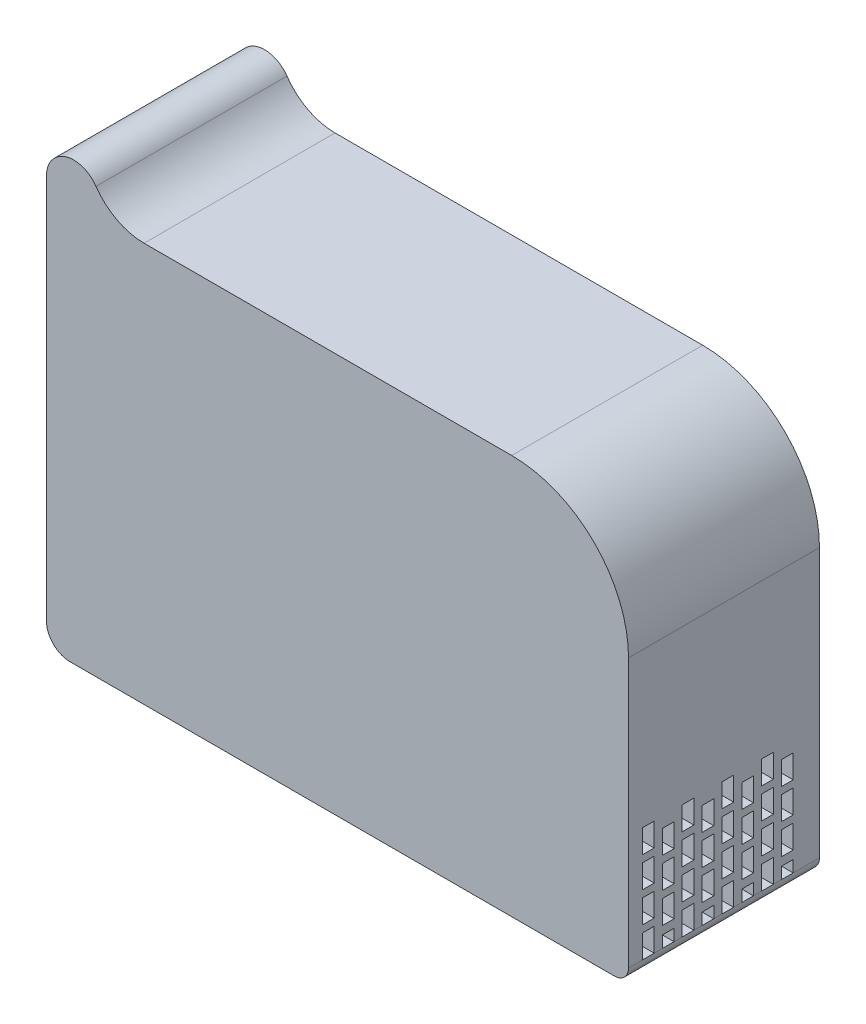
from build123d import *
from build123d.topology import SkipClean

# Parameters (mm, degrees)
FLOOR_2_DEPTH                = 2.4
FLOOR_2_2_DEPTH              = 2.4
FLOOR_2_3_DEPTH              = 2.4
BEARING_LIP_DEPTH            = 0.6
WALLS_DEPTH                  = 66
BEARING_SLEEVE_DEPTH         = 15.6
UPPER_BEARINGLIP_DEPTH       = 0.6
WIRE_GUARD_DEPTH             = 24
MOT_SHELF_DEPTH              = 28
SKETCH1_10_W                 = 2.4
SKETCH1_10_H                 = 8.95
BOT_MOT_SUPPORTS_DEPTH       = 35
TOP_MOT_SUPPORTS_DEPTH       = 7
SKETCH3_W                    = 2.4
SKETCH3_H                    = 8.95
TOP_MOT_SUPPORTS_2_DEPTH     = 7
TOP_MOT_SUPPORTS_3_DEPTH     = 7
SKETCH3_5_W                  = 99.652053124
SKETCH3_5_H                  = 32.7
TOP_DEPTH                    = 2.4
FILLET3_R                    = 20
MOT_SHELF_MATERIAL_REMOVAL_W = 38.7
MOT_SHELF_MATERIAL_REMOVAL_H = 16
CUT_EXTRUDE1_DEPTH           = 4
SCREW_HOLE_EXTRUDE_START     = -1
SCREW_HOLE_EXTRUDE_OUTLINE_R = 2.25
SCREW_HOLE_EXTRUDE_DEPTH     = 31.3
SCREW_SUPPORT_2_R            = 4.25
SCREW_SUPPORT_2_R_2          = 2.25
SCREW_HOLE_2_DEPTH           = 30.3
SCREW_SUPPORT_2_2_R          = 2.25
CUT_EXTRUDE2_DEPTH           = 30.3
TOP_SCREW_9_R                = 2.25
CUT_EXTRUDE6_DEPTH           = 100
TOP_SCREW_SKIN_START         = 30.3
TOP_SCREW_SKIN_DEPTH         = 2.4
TOP_SCREW_HOLE_DEPTH         = 30.3
TOP_SCREW_FILLET_R           = 10
FILLET5_R                    = 4
FILLET7_START                = -1
FILLET7_DEPTH                = 35
CHAMFER2_SIZE                = 2.4
BOSS_EXTRUDE3_DEPTH          = 27.9
FILLET8_R                    = 2.4
FILLET9_R                    = 2
SCREW_HOLE_3_R               = 2.25
BOSS_EXTRUDE4_DEPTH          = 30.3
SCREW_SUPPORT_7_R            = 2.25
CUT_EXTRUDE4_DEPTH           = 100
LED_RESET_HOLES_W            = 2
LED_RESET_HOLES_H            = 4
LED_RESET_HOLES_H_2          = 2
CUT_EXTRUDE5_DEPTH           = 5.5


with BuildPart() as part:
    # Sketch1 → Floor 2 (new body)
    with BuildSketch(Plane(origin=(0, 0, 0), x_dir=(1, 0, 0), z_dir=(0, 1, 0))):
        with BuildLine():
            Line((-15.15, 0), (-22, 0))
            ThreePointArc((-22, 0), (-17.331783846, -13.550249766), (-5.308248299, -21.35))
            Line((-5.308248299, -21.35), (-5.308248299, -30.3))
            Line((-5.308248299, -30.3), (0.5, -30.3))
            Line((0.5, -30.3), (0.5, -29.955960578))
            ThreePointArc((0.5, -29.955960578), (0.001325615, -30.119809063), (-0.5, -30.27535679))
            Line((-0.5, -30.27535679), (-0.5, -15.141746927))
            ThreePointArc((-0.5, -15.141746927), (-10.88800946, -10.534407909), (-15.15, 0))
        make_face()
    extrude(amount=FLOOR_2_DEPTH)


with BuildPart() as body_2:
    # Sketch1 → Floor 2 2 (new body)
    with BuildSketch(Plane(origin=(0, 0, 0), x_dir=(1, 0, 0), z_dir=(0, 1, 0))):
        with BuildLine():
            ThreePointArc((15.15, 0), (10.88800946, -10.534407909), (0.5, -15.141746927))
            Line((0.5, -15.141746927), (0.5, -29.955960578))
            ThreePointArc((0.5, -29.955960578), (16.0686764, -18.436441998), (22, 0))
            Line((22, 0), (15.15, 0))
        make_face()
    extrude(amount=FLOOR_2_2_DEPTH)


with BuildPart() as body_3:
    # Sketch1 → Floor 2 3 (new body)
    with BuildSketch(Plane(origin=(0, 0, 0), x_dir=(1, 0, 0), z_dir=(0, 1, 0))):
        with BuildLine():
            Line((46.843804825, -30.3), (46.843804825, 0))
            Line((46.843804825, 0), (24, 0))
            ThreePointArc((24, 0), (18.84061337, -17.896529995), (4.946046515, -30.3))
            Line((4.946046515, -30.3), (46.843804825, -30.3))
        make_face()
    extrude(amount=FLOOR_2_3_DEPTH)


with BuildPart() as body_4:
    # Sketch1<5> → Bearing_Lip (new body)
    with BuildSketch(Plane(origin=(0, 0, 0), x_dir=(1, 0, 0), z_dir=(0, 1, 0))):
        with BuildLine():
            Line((-9.15, 0), (-11.15, 0))
            ThreePointArc((-11.15, 0), (0, -11.15), (11.15, 0))
            Line((11.15, 0), (9.15, 0))
            ThreePointArc((9.15, 0), (0, -9.15), (-9.15, 0))
        make_face()
    extrude(amount=BEARING_LIP_DEPTH)


with BuildPart() as body_5:
    # Sketch1<6> → Walls (new body)
    with BuildSketch(Plane(origin=(0, 0, 0), x_dir=(1, 0, 0), z_dir=(0, 1, 0))):
        Polygon((-45.608248299, -30.3), (-48.008248299, -30.3), (-48.008248299, -21.35), (-48.008248299, 0), (-50.408248299, 0), (-50.408248299, -32.7), (49.243804825, -32.7), (49.243804825, 0), (46.843804825, 0), (46.843804825, -30.3), (4.946046515, -30.3), (0.5, -30.3), (-0.5, -30.3), (-0.582221737, -30.3), (-5.308248299, -30.3), (-7.708248299, -30.3), (-25.458248299, -30.3), (-27.858248299, -30.3), align=None)
    extrude(amount=WALLS_DEPTH)

    # Sketch3<5> → Top (add)
    with BuildSketch(Plane(origin=(0, 66, 0), x_dir=(1, 0, 0), z_dir=(0, 1, 0))):
        with Locations((-0.582221737, -16.35)):
            Rectangle(SKETCH3_5_W, SKETCH3_5_H)
    extrude(amount=TOP_DEPTH)

    # Fillet3
    fillet3_edges = [body_5.edges().sort_by_distance(p)[0] for p in [
        (46.843804825, 66, 15.15),
        (49.243804825, 68.4, 16.35),
    ]]
    fillet(fillet3_edges, radius=FILLET3_R)

    # Screw_Hole-Extrude: read off the stored shape, not the designer's step
    # Screw_Hole-Extrude outline → Screw_Hole-Extrude (add)
    with BuildSketch(Plane(origin=(0, 0, 30.3), x_dir=(-1, 0, 0), z_dir=(0, 0, -1)).offset(SCREW_HOLE_EXTRUDE_START)):
        with BuildLine():
            Line((-23.65, 2.4), (-15.15, 2.4))
            Line((-15.15, 2.4), (-15.15, 10.9))
            Line((-15.15, 10.9), (-19.4, 10.9))
            ThreePointArc((-19.4, 10.9), (-22.40520382, 9.65520382), (-23.65, 6.65))
            Line((-23.65, 6.65), (-23.65, 2.4))
        make_face()
        with Locations((-19.4, 6.65)):
            Circle(SCREW_HOLE_EXTRUDE_OUTLINE_R, mode=Mode.SUBTRACT)
    extrude(amount=SCREW_HOLE_EXTRUDE_DEPTH)

    # Top_Screw<9> → Cut-Extrude6 (cut)
    with BuildSketch(Plane(origin=(0, 0, 30.3), x_dir=(-1, 0, 0), z_dir=(0, 0, -1))):
        with Locations((45.758248299, 70.06939799)):
            Circle(TOP_SCREW_9_R)
    extrude(amount=CUT_EXTRUDE6_DEPTH, mode=Mode.SUBTRACT)

    # Top_Screw_Skin: read off the stored shape, not the designer's step
    # Top_Screw_Skin outline → Top_Screw_Skin (add)
    with BuildSketch(Plane.XY.offset(TOP_SCREW_SKIN_START)):
        with BuildLine():
            Line((-41.108248299, 68.4), (-41.108248299, 70.06939799))
            ThreePointArc((-41.108248299, 70.06939799), (-45.758248299, 74.71939799), (-50.408248299, 70.06939799))
            Line((-50.408248299, 70.06939799), (-50.408248299, 68.4))
            Line((-50.408248299, 68.4), (-41.108248299, 68.4))
        make_face()
    extrude(amount=TOP_SCREW_SKIN_DEPTH)

    # Top_Screw → Top_Screw_Hole (add)
    with SkipClean():  # the faces are left unmerged after this step: merging them gives an invalid solid
        with BuildSketch(Plane(origin=(0, 0, 30.3), x_dir=(-1, 0, 0), z_dir=(0, 0, -1))):
            with BuildLine():
                ThreePointArc((50.408248299, 70.06939799), (45.758248299, 74.71939799), (41.108248299, 70.06939799))
                Line((41.108248299, 70.06939799), (43.508248299, 70.06939799))
                ThreePointArc((43.508248299, 70.06939799), (45.758248299, 72.31939799), (48.008248299, 70.06939799))
                ThreePointArc((48.008248299, 70.06939799), (47.814537847, 69.156067112), (47.266760927, 68.4))
                Line((47.266760927, 68.4), (50.098249491, 68.4))
                Line((50.098249491, 68.4), (50.408248299, 68.4))
                Line((50.408248299, 68.4), (50.408248299, 70.06939799))
            make_face()
            with BuildLine():
                Line((41.108248299, 70.06939799), (41.108248299, 68.4))
                Line((41.108248299, 68.4), (41.418247106, 68.4))
                Line((41.418247106, 68.4), (44.24973567, 68.4))
                ThreePointArc((44.24973567, 68.4), (43.70195875, 69.156067112), (43.508248299, 70.06939799))
                Line((43.508248299, 70.06939799), (41.108248299, 70.06939799))
            make_face()
        extrude(amount=TOP_SCREW_HOLE_DEPTH)

    # Top_Screw_Fillet
    # the kernel refuses this fillet: 10 mm, written as the material it adds along each edge
    with BuildSketch(Plane(origin=(-41.108248299, 68.4, 30.3), x_dir=(1, 0, 0), z_dir=(0, 0, -1))) as top_screw_fillet_piece_1:
        with BuildLine():
            CenterArc((7.400874248, -10), TOP_SCREW_FILLET_R, 90, 55.344433168)
            Line((-0.824978481, -4.313582246), (-1.647563754, -3.74494047))
            ThreePointArc((-1.647563754, -3.74494047), (-1, -1.66939799), (-1, 0))
            Line((-1, 0), (0, 1))
            Line((0, 1), (7.400874248, 1))
            Line((7.400874248, 1), (7.400874248, 0))
        make_face()
    extrude(amount=30.3)
    with BuildSketch(Plane(origin=(-41.108248299, 68.4, 30.3), x_dir=(1, 0, 0), z_dir=(0, 0, 1))) as top_screw_fillet_piece_2:
        with BuildLine():
            CenterArc((7.400874248, 10), TOP_SCREW_FILLET_R, 214.655566832, 55.344433168)
            Line((-0.824978481, 4.313582246), (-1.647563754, 3.74494047))
            ThreePointArc((-1.647563754, 3.74494047), (-1, 1.66939799), (-1, 0))
            Line((-1, 0), (0, -1))
            Line((0, -1), (7.400874248, -1))
            Line((7.400874248, -1), (7.400874248, 0))
        make_face()
    extrude(amount=2.4)

    # Fillet5
    fillet5_edges = [body_5.edges().sort_by_distance(p)[0] for p in [
        (-50.408248299, 0, 16.35),
    ]]
    fillet(fillet5_edges, radius=FILLET5_R)

    # Fillet7: read off the stored shape, not the designer's step
    # Fillet7 outline → Fillet7 (cut)
    with BuildSketch(Plane.XY.offset(FILLET7_START)):
        with BuildLine():
            Line((49.243804825, 0), (49.243804825, 2.4))
            ThreePointArc((49.243804825, 2.4), (48.5408611, 0.702943725), (46.843804825, 0))
            Line((46.843804825, 0), (49.243804825, 0))
        make_face()
    extrude(amount=FILLET7_DEPTH, mode=Mode.SUBTRACT)

    # PCB_Mount → Boss-Extrude3 (add)
    with BuildSketch(Plane(origin=(0, 0, 30.3), x_dir=(-1, 0, 0), z_dir=(0, 0, -1))):
        with BuildLine():
            ThreePointArc((-40.405146941, 60.7), (-41.110093155, 60.016883294), (-41.780671966, 59.3))
            Line((-41.780671966, 59.3), (-40.243804825, 59.3))
            Line((-40.243804825, 59.3), (-40.243804825, 57.9))
            Line((-40.243804825, 57.9), (-38.843804825, 57.9))
            Line((-38.843804825, 57.9), (-38.843804825, 59.3))
            Line((-38.843804825, 59.3), (-36.843804825, 59.3))
            Line((-36.843804825, 59.3), (-36.843804825, 57.9))
            Line((-36.843804825, 57.9), (-35.443804825, 57.9))
            Line((-35.443804825, 57.9), (-35.443804825, 60.7))
            Line((-35.443804825, 60.7), (-40.405146941, 60.7))
        make_face()
        Polygon((-46.843804825, 23.8), (-46.843804825, 22.4), (-35.443804825, 22.4), (-35.443804825, 25.2), (-36.843804825, 25.2), (-36.843804825, 23.8), (-38.843804825, 23.8), (-38.843804825, 25.2), (-40.243804825, 25.2), (-40.243804825, 23.8), align=None)
    extrude(amount=BOSS_EXTRUDE3_DEPTH)

    # Screw_Hole_3 → Boss-Extrude4 (add)
    with BuildSketch(Plane(origin=(0, 0, 30.3), x_dir=(-1, 0, 0), z_dir=(0, 0, -1))):
        with BuildLine():
            Line((-16.217778263, 66), (-16.217778263, 61.75))
            ThreePointArc((-16.217778263, 61.75), (-11.967778263, 57.5), (-7.717778263, 61.75))
            Line((-7.717778263, 61.75), (-7.717778263, 66))
            Line((-7.717778263, 66), (-16.217778263, 66))
        make_face()
        with Locations(Location((-11.967778263, 61.75, 0), (0, 0, 180))):
            Circle(SCREW_HOLE_3_R, mode=Mode.SUBTRACT)
    extrude(amount=BOSS_EXTRUDE4_DEPTH)

    # led_reset_holes → Cut-Extrude5 (cut)
    with BuildSketch(Plane.ZY.offset(-46.843804825)):
        with Locations((29.3, 20)):
            Rectangle(LED_RESET_HOLES_W, LED_RESET_HOLES_H)
        with Locations((22.5, 20)):
            Rectangle(LED_RESET_HOLES_W, LED_RESET_HOLES_H)
        with Locations((19.1, 18.2)):
            Rectangle(LED_RESET_HOLES_W, LED_RESET_HOLES_H)
        with Locations((15.7, 20)):
            Rectangle(LED_RESET_HOLES_W, LED_RESET_HOLES_H)
        with Locations((12.3, 18.2)):
            Rectangle(LED_RESET_HOLES_W, LED_RESET_HOLES_H)
        with Locations((8.9, 20)):
            Rectangle(LED_RESET_HOLES_W, LED_RESET_HOLES_H)
        with Locations((5.5, 18.2)):
            Rectangle(LED_RESET_HOLES_W, LED_RESET_HOLES_H)
        with Locations((5.5, 13)):
            Rectangle(LED_RESET_HOLES_W, LED_RESET_HOLES_H)
        with Locations((5.5, 7.8)):
            Rectangle(LED_RESET_HOLES_W, LED_RESET_HOLES_H)
        with Locations((5.5, 3.4)):
            Rectangle(LED_RESET_HOLES_W, LED_RESET_HOLES_H_2)
        with Locations((8.9, 4.4)):
            Rectangle(LED_RESET_HOLES_W, LED_RESET_HOLES_H)
        with Locations((8.9, 9.6)):
            Rectangle(LED_RESET_HOLES_W, LED_RESET_HOLES_H)
        with Locations((8.9, 14.8)):
            Rectangle(LED_RESET_HOLES_W, LED_RESET_HOLES_H)
        with Locations((12.3, 13)):
            Rectangle(LED_RESET_HOLES_W, LED_RESET_HOLES_H)
        with Locations((12.3, 7.8)):
            Rectangle(LED_RESET_HOLES_W, LED_RESET_HOLES_H)
        with Locations((15.7, 4.4)):
            Rectangle(LED_RESET_HOLES_W, LED_RESET_HOLES_H)
        with Locations((15.7, 9.6)):
            Rectangle(LED_RESET_HOLES_W, LED_RESET_HOLES_H)
        with Locations((15.7, 14.8)):
            Rectangle(LED_RESET_HOLES_W, LED_RESET_HOLES_H)
        with Locations((19.1, 13)):
            Rectangle(LED_RESET_HOLES_W, LED_RESET_HOLES_H)
        with Locations((19.1, 7.8)):
            Rectangle(LED_RESET_HOLES_W, LED_RESET_HOLES_H)
        with Locations((19.1, 3.4)):
            Rectangle(LED_RESET_HOLES_W, LED_RESET_HOLES_H_2)
        with Locations((22.5, 4.4)):
            Rectangle(LED_RESET_HOLES_W, LED_RESET_HOLES_H)
        with Locations((22.5, 9.6)):
            Rectangle(LED_RESET_HOLES_W, LED_RESET_HOLES_H)
        with Locations((22.5, 14.8)):
            Rectangle(LED_RESET_HOLES_W, LED_RESET_HOLES_H)
        with Locations((25.9, 13)):
            Rectangle(LED_RESET_HOLES_W, LED_RESET_HOLES_H)
        with Locations((25.9, 7.8)):
            Rectangle(LED_RESET_HOLES_W, LED_RESET_HOLES_H)
        with Locations((29.3, 4.4)):
            Rectangle(LED_RESET_HOLES_W, LED_RESET_HOLES_H)
        with Locations((29.3, 9.6)):
            Rectangle(LED_RESET_HOLES_W, LED_RESET_HOLES_H)
        with Locations((25.9, 18.2)):
            Rectangle(LED_RESET_HOLES_W, LED_RESET_HOLES_H)
        with Locations((12.3, 3.4)):
            Rectangle(LED_RESET_HOLES_W, LED_RESET_HOLES_H_2)
        with Locations((25.9, 3.4)):
            Rectangle(LED_RESET_HOLES_W, LED_RESET_HOLES_H_2)
        with Locations((29.3, 14.8)):
            Rectangle(LED_RESET_HOLES_W, LED_RESET_HOLES_H)
    extrude(amount=-CUT_EXTRUDE5_DEPTH, mode=Mode.SUBTRACT)


with BuildPart() as body_6:
    # Sketch1<7> → Bearing_Sleeve (new body)
    with BuildSketch(Plane(origin=(0, 0, 0), x_dir=(1, 0, 0), z_dir=(0, 1, 0))):
        with BuildLine():
            Line((-11.15, 0), (-15.15, 0))
            ThreePointArc((-15.15, 0), (-10.88800946, -10.534407909), (-0.5, -15.141746927))
            Line((-0.5, -15.141746927), (-0.5, -30.27535679))
            ThreePointArc((-0.5, -30.27535679), (0.001325615, -30.119809063), (0.5, -29.955960578))
            Line((0.5, -29.955960578), (0.5, -15.141746927))
            ThreePointArc((0.5, -15.141746927), (10.88800946, -10.534407909), (15.15, 0))
            Line((15.15, 0), (11.15, 0))
            ThreePointArc((11.15, 0), (0, -11.15), (-11.15, 0))
        make_face()
    extrude(amount=BEARING_SLEEVE_DEPTH)

    # Sketch6 → Upper_BearingLip (add)
    with BuildSketch(Plane(origin=(0, 15.6, 0), x_dir=(1, 0, 0), z_dir=(0, 1, 0))):
        with BuildLine():
            Line((-9.15, 0), (-11.15, 0))
            ThreePointArc((-11.15, 0), (0, -11.15), (11.15, 0))
            Line((11.15, 0), (9.15, 0))
            ThreePointArc((9.15, 0), (0, -9.15), (-9.15, 0))
        make_face()
    extrude(amount=-UPPER_BEARINGLIP_DEPTH)


with BuildPart() as body_7:
    # Sketch1<8> → Wire_Guard (new body)
    with BuildSketch(Plane(origin=(0, 0, 0), x_dir=(1, 0, 0), z_dir=(0, 1, 0))):
        with BuildLine():
            ThreePointArc((4.946046515, -30.3), (18.84061337, -17.896529995), (24, 0))
            Line((24, 0), (22, 0))
            ThreePointArc((22, 0), (16.0686764, -18.436441998), (0.5, -29.955960578))
            Line((0.5, -29.955960578), (0.5, -30.3))
            Line((0.5, -30.3), (4.946046515, -30.3))
        make_face()
    extrude(amount=WIRE_GUARD_DEPTH)

    # Screw_Support<7> → Cut-Extrude4 (cut)
    with BuildSketch(Plane(origin=(0, 0, 30.3), x_dir=(-1, 0, 0), z_dir=(0, 0, -1))):
        with Locations(Location((-19.4, 6.65, 0), (0, 0, 180))):
            Circle(SCREW_SUPPORT_7_R)
    extrude(amount=CUT_EXTRUDE4_DEPTH, mode=Mode.SUBTRACT)


with BuildPart() as body_8:
    # Sketch1<9> → Mot_Shelf (new body)
    with BuildSketch(Plane(origin=(0, 0, 0), x_dir=(1, 0, 0), z_dir=(0, 1, 0))):
        with BuildLine():
            Line((-48.008248299, 0), (-48.008248299, -21.35))
            Line((-48.008248299, -21.35), (-45.608248299, -21.35))
            Line((-45.608248299, -21.35), (-27.858248299, -21.35))
            Line((-27.858248299, -21.35), (-25.458248299, -21.35))
            Line((-25.458248299, -21.35), (-7.708248299, -21.35))
            Line((-7.708248299, -21.35), (-5.308248299, -21.35))
            ThreePointArc((-5.308248299, -21.35), (-9.627609708, -19.78153511), (-13.526917609, -17.35))
            Line((-13.526917609, -17.35), (-44.008248299, -17.35))
            Line((-44.008248299, -17.35), (-44.008248299, 0))
            Line((-44.008248299, 0), (-48.008248299, 0))
        make_face()
    extrude(amount=MOT_SHELF_DEPTH)

    # Sketch1<10> → Bot_Mot_Supports (add)
    with BuildSketch(Plane(origin=(0, 0, 0), x_dir=(1, 0, 0), z_dir=(0, 1, 0))):
        with Locations((-6.508248299, -25.825)):
            Rectangle(SKETCH1_10_W, SKETCH1_10_H)
        with Locations((-26.658248299, -25.825)):
            Rectangle(SKETCH1_10_W, SKETCH1_10_H)
        with Locations((-46.808248299, -25.825)):
            Rectangle(SKETCH1_10_W, SKETCH1_10_H)
    extrude(amount=BOT_MOT_SUPPORTS_DEPTH)

    # mot_shelf_material_removal → Cut-Extrude1 (cut)
    with BuildSketch(Plane(origin=(0, 0, 17.35), x_dir=(-1, 0, 0), z_dir=(0, 0, -1))):
        with Locations((24.658248299, 14)):
            Rectangle(MOT_SHELF_MATERIAL_REMOVAL_W, MOT_SHELF_MATERIAL_REMOVAL_H)
    extrude(amount=-CUT_EXTRUDE1_DEPTH, mode=Mode.SUBTRACT)

    # Screw_Support 2 → Screw_Hole_2 (add)
    # profile 1 of 4: a face of its own
    with BuildSketch(Plane(origin=(0, 0, 30.3), x_dir=(-1, 0, 0), z_dir=(0, 0, -1))):
        with Locations((19.4, 6.65)):
            Circle(SCREW_SUPPORT_2_R)
        with Locations((19.4, 6.65)):
            Circle(SCREW_SUPPORT_2_R_2, mode=Mode.SUBTRACT)
    # profile 2 of 4: a face of its own
    with BuildSketch(Plane(origin=(0, 0, 30.3), x_dir=(-1, 0, 0), z_dir=(0, 0, -1))):
        with BuildLine():
            Line((15.15, 14), (15.15, 6.65))
            ThreePointArc((15.15, 6.65), (17.272569365, 10.329203568), (21.520135951, 10.333411944))
            Line((21.520135951, 10.333411944), (15.15, 14))
        make_face()
    # profile 3 of 4: a face of its own
    with BuildSketch(Plane(origin=(0, 0, 30.3), x_dir=(-1, 0, 0), z_dir=(0, 0, -1))):
        with BuildLine():
            Line((15.15, 2.4), (19.4, 2.4))
            ThreePointArc((19.4, 2.4), (16.39479618, 3.64479618), (15.15, 6.65))
            Line((15.15, 6.65), (15.15, 2.4))
        make_face()
    # profile 4 of 4: a face of its own
    with BuildSketch(Plane(origin=(0, 0, 30.3), x_dir=(-1, 0, 0), z_dir=(0, 0, -1))):
        with BuildLine():
            Line((19.4, 2.4), (22, 2.4))
            Line((22, 2.4), (23.183865445, 4.714835331))
            ThreePointArc((23.183865445, 4.714835331), (21.617887526, 3.024606929), (19.4, 2.4))
        make_face()
    extrude(amount=SCREW_HOLE_2_DEPTH)

    # Screw_Support 2<2> → Cut-Extrude2 (cut)
    with BuildSketch(Plane(origin=(0, 0, 30.3), x_dir=(-1, 0, 0), z_dir=(0, 0, -1))):
        with Locations((19.4, 6.65)):
            Circle(SCREW_SUPPORT_2_2_R)
    extrude(amount=CUT_EXTRUDE2_DEPTH, mode=Mode.SUBTRACT)

    # Chamfer2
    # the kernel refuses this chamfer: 2.4 mm, written as the material it adds along each edge
    with BuildSketch(Plane(origin=(-27.858248299, 22, 21.35), x_dir=(-1, 0, 0), z_dir=(0, 1, 0)), Plane(origin=(-25.458248299, 0, 21.35), x_dir=(0, 0, 1), z_dir=(0, 1, 0)), Plane(origin=(-27.858248299, 0, 21.35), x_dir=(-1, 0, 0), z_dir=(0, 1, 0)), Plane(origin=(-7.708248299, 22, 21.35), x_dir=(-1, 0, 0), z_dir=(0, 1, 0)), Plane(origin=(-7.708248299, 0, 21.35), x_dir=(-1, 0, 0), z_dir=(0, 1, 0))) as chamfer2_piece_1:
        Polygon((CHAMFER2_SIZE, 0), (0, CHAMFER2_SIZE), (0, 0), align=None)
    extrude(amount=6)
    with BuildSketch(Plane(origin=(-25.458248299, 22, 21.35), x_dir=(1, 0, 0), z_dir=(0, 1, 0))) as chamfer2_piece_2:
        Polygon((CHAMFER2_SIZE, 0), (0, -CHAMFER2_SIZE), (0, 0), align=None)
    extrude(amount=6)

    # Fillet8
    # the kernel refuses this fillet: 2.4 mm, written as the material it takes off along each edge
    with BuildSketch(Plane(origin=(-44.008248299, 6, 21.35), x_dir=(0, 0, -1), z_dir=(0, 1, 0))) as fillet8_piece_1:
        with BuildLine():
            CenterArc((2.2627417, 2.4), FILLET8_R, 199.471220634, 70.528779366)
            Line((0, 1.6), (-0.045254834, 1.584))
            ThreePointArc((-0.045254834, 1.584), (-0.048, 0.8), (-0.048, 0))
            Line((-0.048, 0), (0, -0.048))
            Line((0, -0.048), (2.2627417, -0.048))
            Line((2.2627417, -0.048), (2.2627417, 0))
        make_face()
    extrude(amount=16, mode=Mode.SUBTRACT)

    # Fillet9
    # the kernel refuses this fillet: 2 mm, written as the material it takes off along each edge
    with BuildSketch(Plane(origin=(-28.058248299, 0, 21.35), x_dir=(0, 1, 0), z_dir=(1, 0, 0))) as fillet9_piece_1_section:
        with BuildLine():
            CenterArc((FILLET9_R, -FILLET9_R), FILLET9_R, 90, 90)
            Line((0, -FILLET9_R), (0, 0))
            Line((0, 0), (FILLET9_R, 0))
        make_face()
    fillet9_piece_1 = extrude(amount=22.95, mode=Mode.PRIVATE)
    fillet9_piece_1 = split(fillet9_piece_1, bisect_by=Plane(origin=(-25.558248299, 0, 23.85), z_dir=(0.7071067811865476, 0, 0.7071067811865476)), keep=Keep.TOP, mode=Mode.PRIVATE)
    fillet9_piece_1 = split(fillet9_piece_1, bisect_by=Plane(origin=(-19.083248299, 0, 12.375), z_dir=(-0.7071067811865476, 0, 0.7071067811865476)), keep=Keep.TOP, mode=Mode.PRIVATE)
    add(fillet9_piece_1, mode=Mode.SUBTRACT)
    with BuildSketch(Plane(origin=(-13.643782205, 0, 17.814466094), x_dir=(0.7071067811865476, 0, -0.7071067811865476), z_dir=(0.7071067811865476, 0, 0.7071067811865476))) as fillet9_piece_2_section:
        with BuildLine():
            CenterArc((FILLET9_R, FILLET9_R), FILLET9_R, 180, 90)
            Line((0, FILLET9_R), (0, 0))
            Line((0, 0), (FILLET9_R, 0))
        make_face()
    fillet9_piece_2 = extrude(amount=13.39411255, mode=Mode.PRIVATE)
    fillet9_piece_2 = split(fillet9_piece_2, bisect_by=Plane(origin=(-7.708248299, 0, 17.814466094), z_dir=(-1, 0, 0)), keep=Keep.TOP, mode=Mode.PRIVATE)
    fillet9_piece_2 = split(fillet9_piece_2, bisect_by=Plane(origin=(-13.643782205, 0, 21.35), z_dir=(0, 0, 1)), keep=Keep.TOP, mode=Mode.PRIVATE)
    add(fillet9_piece_2, mode=Mode.SUBTRACT)
    with BuildSketch(Plane(origin=(-28.993782205, 0, 27.285533906), x_dir=(0, 1, 0), z_dir=(0.7071067811865476, 0, -0.7071067811865476))) as fillet9_piece_3_section:
        with BuildLine():
            CenterArc((FILLET9_R, -FILLET9_R), FILLET9_R, 90, 90)
            Line((0, -FILLET9_R), (0, 0))
            Line((0, 0), (FILLET9_R, 0))
        make_face()
    fillet9_piece_3 = extrude(amount=13.39411255, mode=Mode.PRIVATE)
    fillet9_piece_3 = split(fillet9_piece_3, bisect_by=Plane(origin=(-28.993782205, 0, 21.35), z_dir=(0, 0, 1)), keep=Keep.TOP, mode=Mode.PRIVATE)
    fillet9_piece_3 = split(fillet9_piece_3, bisect_by=Plane(origin=(-25.458248299, 0, 27.285533906), z_dir=(1, 0, 0)), keep=Keep.TOP, mode=Mode.PRIVATE)
    add(fillet9_piece_3, mode=Mode.SUBTRACT)
    with BuildSketch(Plane(origin=(-28.058248299, 0, 21.35), x_dir=(0, 1, 0), z_dir=(1, 0, 0))) as fillet9_piece_4a_section:
        with BuildLine():
            CenterArc((FILLET9_R, -FILLET9_R), FILLET9_R, 90, 90)
            Line((0, -FILLET9_R), (0, 0))
            Line((0, 0), (FILLET9_R, 0))
        make_face()
    fillet9_piece_4a = extrude(amount=22.95, mode=Mode.PRIVATE)
    fillet9_piece_4a = split(fillet9_piece_4a, bisect_by=Plane(origin=(-25.558248299, 0, 23.85), z_dir=(-0.7071067811865476, 0, -0.7071067811865476)), keep=Keep.TOP, mode=Mode.PRIVATE)
    with BuildSketch(Plane(origin=(-28.993782205, 0, 27.285533906), x_dir=(0, 1, 0), z_dir=(0.7071067811865476, 0, -0.7071067811865476))) as fillet9_piece_4b_section:
        with BuildLine():
            CenterArc((FILLET9_R, -FILLET9_R), FILLET9_R, 90, 90)
            Line((0, -FILLET9_R), (0, 0))
            Line((0, 0), (FILLET9_R, 0))
        make_face()
    fillet9_piece_4b = extrude(amount=13.39411255, mode=Mode.PRIVATE)
    fillet9_piece_4b = split(fillet9_piece_4b, bisect_by=Plane(origin=(-28.993782205, 0, 17.35), z_dir=(0, 0, 1)), keep=Keep.TOP, mode=Mode.PRIVATE)
    fillet9_piece_4b = split(fillet9_piece_4b, bisect_by=Plane(origin=(-28.993782205, 0, 21.35), z_dir=(0, 0, -1)), keep=Keep.TOP, mode=Mode.PRIVATE)
    fillet9_piece_4b = split(fillet9_piece_4b, bisect_by=Plane(origin=(-25.458248299, 0, 27.285533906), z_dir=(1, 0, 0)), keep=Keep.TOP, mode=Mode.PRIVATE)
    fillet9_piece_4 = fillet9_piece_4a & fillet9_piece_4b
    add(fillet9_piece_4, mode=Mode.SUBTRACT)
    with BuildSketch(Plane(origin=(-28.058248299, 0, 21.35), x_dir=(0, 1, 0), z_dir=(1, 0, 0))) as fillet9_piece_5a_section:
        with BuildLine():
            CenterArc((FILLET9_R, -FILLET9_R), FILLET9_R, 90, 90)
            Line((0, -FILLET9_R), (0, 0))
            Line((0, 0), (FILLET9_R, 0))
        make_face()
    fillet9_piece_5a = extrude(amount=22.95, mode=Mode.PRIVATE)
    fillet9_piece_5a = fillet9_piece_5a - Plane(origin=(0, 0, 0), x_dir=(-0.24128401357450216, 0, 0.9704545454545409), z_dir=(0, -1, 0)) * Cylinder(22, 54, mode=Mode.PRIVATE)
    fillet9_piece_5a = split(fillet9_piece_5a, bisect_by=Plane(origin=(-19.083248299, 0, 12.375), z_dir=(0.7071067811865476, 0, -0.7071067811865476)), keep=Keep.TOP, mode=Mode.PRIVATE)
    with BuildSketch(Plane(origin=(-13.643782205, 0, 17.814466094), x_dir=(0.7071067811865476, 0, -0.7071067811865476), z_dir=(0.7071067811865476, 0, 0.7071067811865476))) as fillet9_piece_5b_section:
        with BuildLine():
            CenterArc((FILLET9_R, FILLET9_R), FILLET9_R, 180, 90)
            Line((0, FILLET9_R), (0, 0))
            Line((0, 0), (FILLET9_R, 0))
        make_face()
    fillet9_piece_5b = extrude(amount=13.39411255, mode=Mode.PRIVATE)
    fillet9_piece_5b = split(fillet9_piece_5b, bisect_by=Plane(origin=(-7.708248299, 0, 17.814466094), z_dir=(-1, 0, 0)), keep=Keep.TOP, mode=Mode.PRIVATE)
    fillet9_piece_5b = fillet9_piece_5b - Plane(origin=(0, 0, 0), x_dir=(-0.24128401357450216, 0, 0.9704545454545409), z_dir=(0, -1, 0)) * Cylinder(22, 35, mode=Mode.PRIVATE)
    fillet9_piece_5b = split(fillet9_piece_5b, bisect_by=Plane(origin=(-13.643782205, 0, 21.35), z_dir=(0, 0, -1)), keep=Keep.TOP, mode=Mode.PRIVATE)
    fillet9_piece_5 = fillet9_piece_5a & fillet9_piece_5b
    add(fillet9_piece_5, mode=Mode.SUBTRACT)


with BuildPart() as body_9:
    # Sketch3 → Top_Mot_Supports (new body)
    with BuildSketch(Plane(origin=(0, 66, 0), x_dir=(1, 0, 0), z_dir=(0, 1, 0))):
        Polygon((-7.708248299, -21.35), (-7.708248299, -30.3), (-2.908248299, -30.3), (-2.908248299, -11), (-5.308248299, -11), (-5.308248299, -21.35), align=None)
    extrude(amount=-TOP_MOT_SUPPORTS_DEPTH)


with BuildPart() as body_10:
    # Sketch3 → Top_Mot_Supports 2 (new body)
    with BuildSketch(Plane(origin=(0, 66, 0), x_dir=(1, 0, 0), z_dir=(0, 1, 0))):
        with Locations((-26.658248299, -25.825)):
            Rectangle(SKETCH3_W, SKETCH3_H)
    extrude(amount=-TOP_MOT_SUPPORTS_2_DEPTH)


with BuildPart() as body_11:
    # Sketch3 → Top_Mot_Supports 3 (new body)
    with BuildSketch(Plane(origin=(0, 66, 0), x_dir=(1, 0, 0), z_dir=(0, 1, 0))):
        with Locations((-46.808248299, -25.825)):
            Rectangle(SKETCH3_W, SKETCH3_H)
    extrude(amount=-TOP_MOT_SUPPORTS_3_DEPTH)


solid = Compound([part.part, body_2.part, body_3.part, body_4.part, body_5.part, body_6.part, body_7.part, body_8.part, body_9.part, body_10.part, body_11.part])
